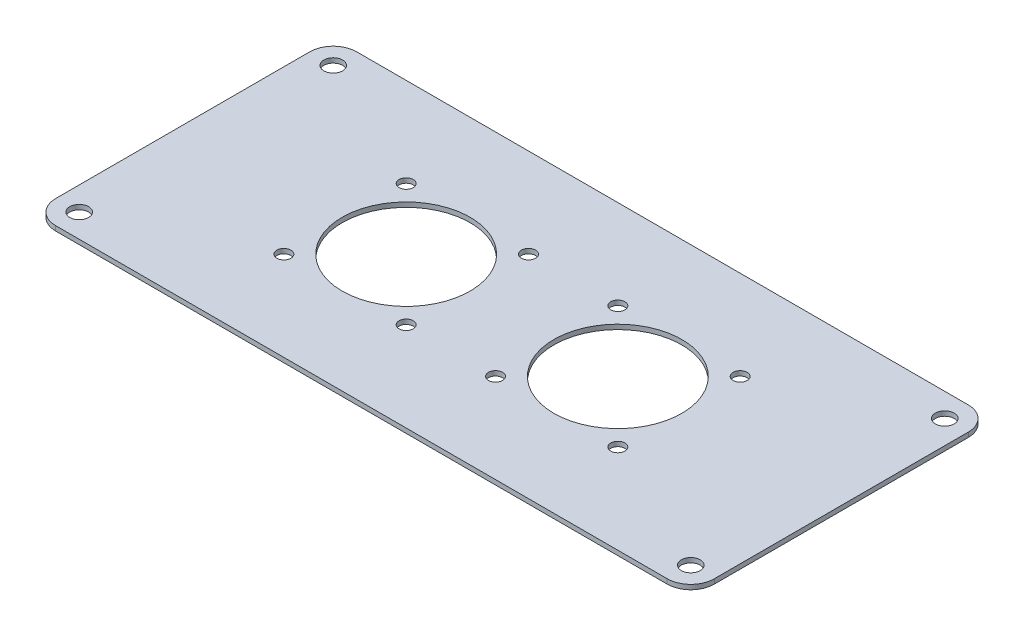
from build123d import *

# Parameters (mm, degrees)
SKETCH_1_W             = 140
SKETCH_1_H             = 64
SM_BASE_FLANGE_1_DEPTH = 1
FILLET_1_R             = 5
SKETCH_4_R             = 2
CUT_EXTRUDE_2_DEPTH    = 10
SKETCH_5_R             = 13.6
SKETCH_5_R_2           = 1.5
CUT_EXTRUDE_3_DEPTH    = 10


# Sheet-metal steps are written as plain solids
with BuildPart() as part:
    # Sketch 1 → Базовая кромка1 (new body)
    with BuildSketch(Plane(origin=(0, 0, 0), x_dir=(1, 0, 0), z_dir=(0, 1, 0))):
        with Locations((16.228693113, 2.194635649)):
            Rectangle(SKETCH_1_W, SKETCH_1_H)
    extrude(amount=-SM_BASE_FLANGE_1_DEPTH)

    # Скругление1
    fillet_1_edges = [part.edges().sort_by_distance(p)[0] for p in [
        (-53.771306887, -0.5, -34.194635649),
        (86.228693113, -0.5, -34.194635649),
        (86.228693113, -0.5, 29.805364351),
        (-53.771306887, -0.5, 29.805364351),
    ]]
    fillet(fillet_1_edges, radius=FILLET_1_R)

    # Эскиз4 → Вырез-Вытянуть2 (cut)
    with BuildSketch(Plane(origin=(0, 0, 0), x_dir=(1, 0, 0), z_dir=(0, 1, 0))):
        with Locations(Location((-48.771306887, 29.194635649, 0), (0, 0, 270))):
            Circle(SKETCH_4_R)
        with Locations(Location((81.228693113, 29.194635649, 0), (0, 0, 270))):
            Circle(SKETCH_4_R)
        with Locations(Location((-48.771306887, -24.805364351, 0), (0, 0, 270))):
            Circle(SKETCH_4_R)
        with Locations(Location((81.228693113, -24.805364351, 0), (0, 0, 270))):
            Circle(SKETCH_4_R)
    extrude(amount=-CUT_EXTRUDE_2_DEPTH, mode=Mode.SUBTRACT)

    # Эскиз5 → Вырез-Вытянуть3 (cut)
    with BuildSketch(Plane(origin=(0, 0, 0), x_dir=(1, 0, 0), z_dir=(0, 1, 0))):
        with Locations(Location((-6.271306887, 2.194635649, 0), (0, 0, 270))):
            Circle(SKETCH_5_R)
        with Locations(Location((38.728693113, 2.194635649, 0), (0, 0, 270))):
            Circle(SKETCH_5_R)
        with Locations(Location((-19.271306887, 15.194635649, 0), (0, 0, 270))):
            Circle(SKETCH_5_R_2)
        with Locations(Location((6.728693113, 15.194635649, 0), (0, 0, 270))):
            Circle(SKETCH_5_R_2)
        with Locations(Location((-19.271306887, -10.805364351, 0), (0, 0, 270))):
            Circle(SKETCH_5_R_2)
        with Locations(Location((6.728693113, -10.805364351, 0), (0, 0, 270))):
            Circle(SKETCH_5_R_2)
        with Locations(Location((25.728693113, 15.194635649, 0), (0, 0, 270))):
            Circle(SKETCH_5_R_2)
        with Locations(Location((51.728693113, 15.194635649, 0), (0, 0, 270))):
            Circle(SKETCH_5_R_2)
        with Locations(Location((25.728693113, -10.805364351, 0), (0, 0, 270))):
            Circle(SKETCH_5_R_2)
        with Locations(Location((51.728693113, -10.805364351, 0), (0, 0, 270))):
            Circle(SKETCH_5_R_2)
    extrude(amount=-CUT_EXTRUDE_3_DEPTH, mode=Mode.SUBTRACT)


solid = part.part
